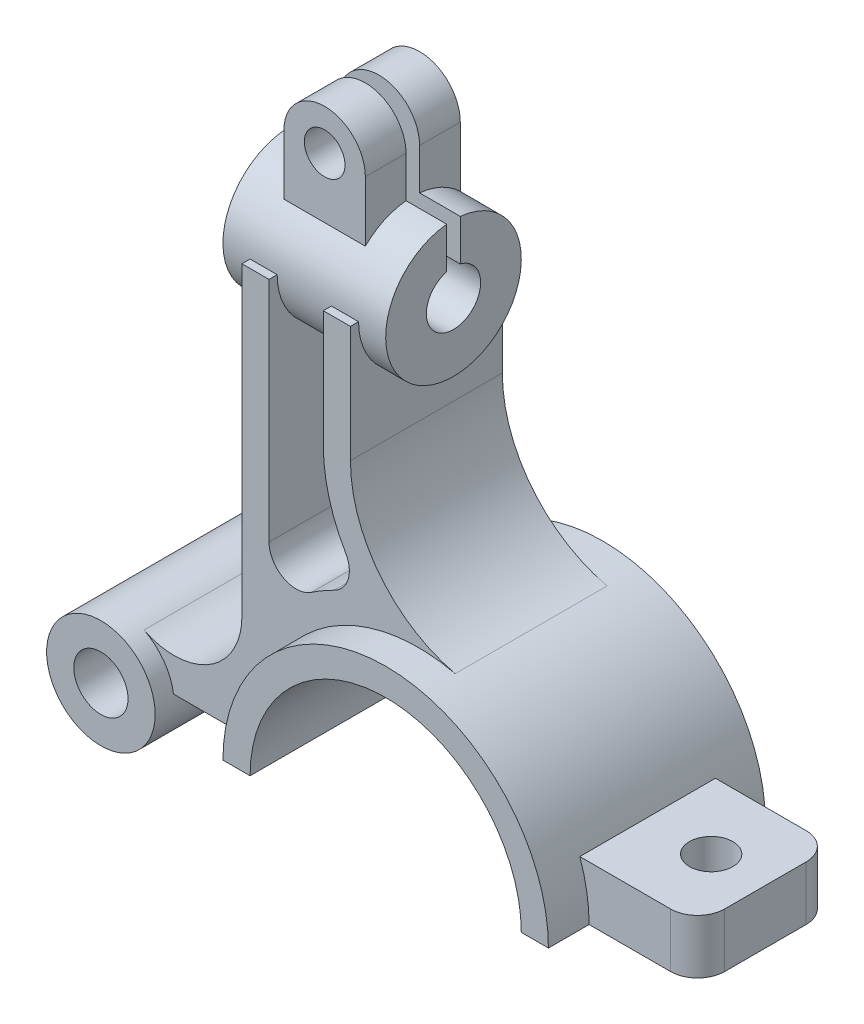
from build123d import *

# Parameters (mm, degrees)
EXTRUDE_THIN1_DEPTH          = 40
SKETCH2_R                    = 20
SKETCH2_R_2                  = 10
EXTRUDE_THIN2_DEPTH          = 35
SKETCH3_W                    = 100
SKETCH3_H                    = 50
BOSS_EXTRUDE1_DEPTH          = 20
DELETEFACE4_START            = -25
DELETEFACE4_DEPTH            = 50
FILLET1_R                    = 10
SKETCH5_W                    = 8
SKETCH5_H                    = 42.929151324
SKETCH6_R                    = 25
BOSS_EXTRUDE2_DEPTH          = 60
SKETCH7_R                    = 7.5
BOSS_EXTRUDE3_DEPTH          = 17.5
BOSS_EXTRUDE4_DEPTH          = 28
F_20_0_20_DIAMETER_HOLE1_D   = 20
CUT_EXTRUDE_THIN1_DEPTH      = 239.432380351
CUT_EXTRUDE_THIN1_DEPTH_BACK = 239.432380351
SKETCH11_W                   = 5
SKETCH11_H                   = 55


# Read off the part's stored shape, not the designer's step: DeleteFace4
with BuildPart() as part:
    # Sketch1 → Extrude-Thin1 (new, symmetric)
    with BuildSketch(Plane.XY):
        with BuildLine():
            ThreePointArc((60, 0), (0, 60), (-60, 0))
            Line((-60, 0), (-50, 0))
            ThreePointArc((-50, 0), (0, 50), (50, 0))
            Line((50, 0), (60, 0))
        make_face()
    extrude(amount=EXTRUDE_THIN1_DEPTH, both=True)

    # Sketch3 → Boss-Extrude1 (add)
    with BuildSketch(Plane.XZ):
        with Locations((50, 0)):
            Rectangle(SKETCH3_W, SKETCH3_H)
    extrude(amount=-BOSS_EXTRUDE1_DEPTH)

    # DeleteFace4 outline → DeleteFace4 (cut)
    with BuildSketch(Plane.XY.offset(DELETEFACE4_START)):
        with BuildLine():
            ThreePointArc((50, 0), (48.945315647, 10.215482184), (45.82575695, 20))
            Line((45.82575695, 20), (0, 20))
            Line((0, 20), (0, 0))
            Line((0, 0), (50, 0))
        make_face()
    extrude(amount=DELETEFACE4_DEPTH, mode=Mode.SUBTRACT)

    # Fillet1
    fillet1_edges = [part.edges().sort_by_distance(p)[0] for p in [
        (100, 10, -25),
        (100, 10, 25),
    ]]
    fillet(fillet1_edges, radius=FILLET1_R)

    # Sketch5 → Ø16.0 (16) Diameter Hole1 (revolve, cut)
    with BuildSketch(Plane(origin=(80, 20, 0), x_dir=(0, 0, 1), z_dir=(1, 0, 0))):
        with Locations((4, 21.464575662)):
            Rectangle(SKETCH5_W, SKETCH5_H)
    revolve(axis=Axis((80, 26.35, 0), (0, -1, 0)), mode=Mode.SUBTRACT)



with BuildPart() as body_2:
    # Sketch2 → Extrude-Thin2 (new, symmetric)
    with BuildSketch(Plane.XY):
        with Locations((-110, -2.929151324)):
            Circle(SKETCH2_R)
        with Locations((-110, -2.929151324)):
            Circle(SKETCH2_R_2, mode=Mode.SUBTRACT)
    extrude(amount=EXTRUDE_THIN2_DEPTH, both=True)


with BuildPart() as body_3:
    # Sketch6 → Boss-Extrude2 (new body)
    with BuildSketch(Plane(origin=(-15, 0, 0), x_dir=(0, 0, -1), z_dir=(1, 0, 0))):
        with Locations((0, 150)):
            Circle(SKETCH6_R)
    extrude(amount=-BOSS_EXTRUDE2_DEPTH)

    # Sketch7 → Boss-Extrude3 (add, symmetric)
    with BuildSketch(Plane.XY):
        with BuildLine():
            Line((-60, 150), (-60, 190))
            ThreePointArc((-60, 190), (-45, 205), (-30, 190))
            Line((-30, 190), (-30, 150))
            Line((-30, 150), (-60, 150))
        make_face()
        with Locations((-45, 190)):
            Circle(SKETCH7_R, mode=Mode.SUBTRACT)
    extrude(amount=BOSS_EXTRUDE3_DEPTH, both=True)


with BuildPart() as part_1:
    add(part.part)

    add(body_2.part)  # Boss-Extrude4 merges body 2

    add(body_3.part)  # Boss-Extrude4 merges body 3
    # Sketch8 → Boss-Extrude4 (add, symmetric)
    with BuildSketch(Plane.XY):
        with BuildLine():
            Line((-25, 150), (-25, 107.121426428))
            ThreePointArc((-25, 107.121426428), (-14.16747259, 76.042348403), (13.636363636, 58.429868961))
            ThreePointArc((13.636363636, 58.429868961), (-37.29489363, 47.000967108), (-60, 0))
            Line((-60, 0), (-90.215660928, 0))
            ThreePointArc((-90.215660928, 0), (-93.823137808, 8.831338871), (-101.111111111, 14.986977006))
            ThreePointArc((-101.111111111, 14.986977006), (-76.823843083, 16.136222778), (-65, 37.382137418))
            Line((-65, 37.382137418), (-65, 150))
            Line((-65, 150), (-55, 150))
            Line((-55, 150), (-55, 66.143782777))
            ThreePointArc((-55, 66.143782777), (-49.677071733, 57.304948012), (-39.375, 57.87580993))
            ThreePointArc((-39.375, 57.87580993), (-35.260419238, 60.470677482), (-30.975558625, 62.773519639))
            ThreePointArc((-30.975558625, 62.773519639), (-25.821810248, 68.869571549), (-26.771975796, 76.79548832))
            ThreePointArc((-26.771975796, 76.79548832), (-32.906470052, 91.410260777), (-35, 107.121426428))
            Line((-35, 107.121426428), (-35, 150))
            Line((-35, 150), (-25, 150))
        make_face()
    extrude(amount=BOSS_EXTRUDE4_DEPTH, both=True)

    # Ø20.0 (20) Diameter Hole1 (through all)
    with Locations(Plane(origin=(-15, 0, 0), x_dir=(0, 0, -1), z_dir=(1, 0, 0))):
        with Locations((0, 150)):
            Hole(F_20_0_20_DIAMETER_HOLE1_D / 2)

    # Sketch11 → Cut-Extrude-Thin1 (cut, two sides: drawn at the far end of the back side and taken through both)
    with BuildSketch(Plane(origin=(-15, 0, 0), x_dir=(0, 0, -1), z_dir=(1, 0, 0)).offset(-CUT_EXTRUDE_THIN1_DEPTH_BACK)):
        with Locations((0, 177.5)):
            Rectangle(SKETCH11_W, SKETCH11_H)
    extrude(amount=CUT_EXTRUDE_THIN1_DEPTH + CUT_EXTRUDE_THIN1_DEPTH_BACK, mode=Mode.SUBTRACT)


solid = part_1.part
